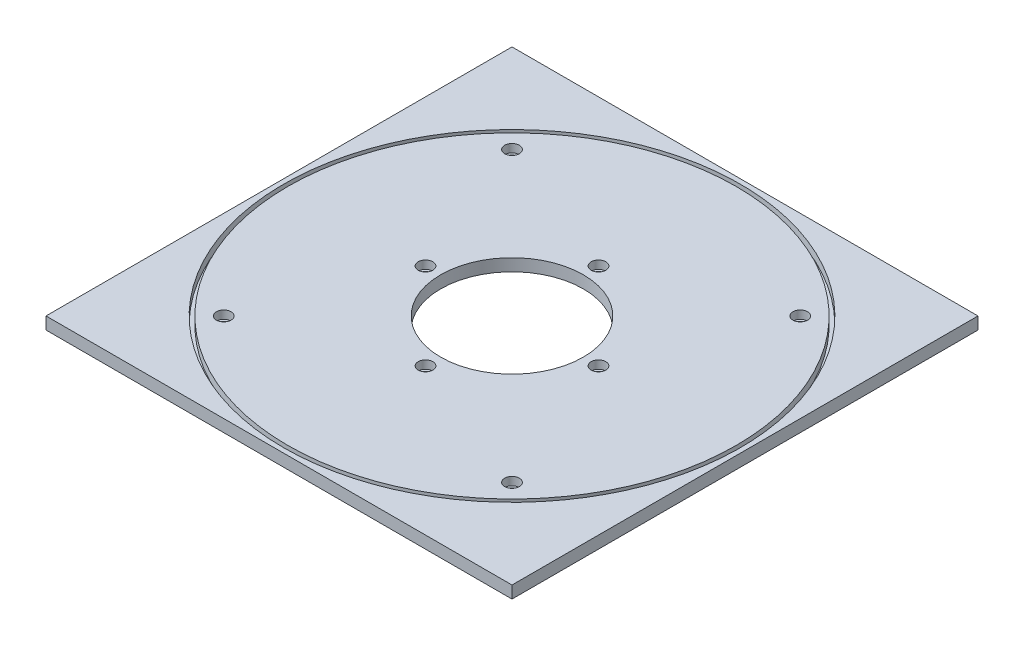
from build123d import *

# Parameters (mm, degrees)
SKETCH1_W                      = 571.5
SKETCH1_H                      = 571.5
PLATE_DEPTH                    = 15
SKETCH2_R                      = 87.5
BEARING_HOLE_DEPTH             = 405.389818121
SKETCH4_R                      = 280
SKETCH4_R_2                    = 275
CUT_EXTRUDE3_DEPTH             = 10
CBORE_FOR_M10_SHCS_D           = 12
CBORE_FOR_M10_SHCS_CBORE_D     = 18
CBORE_FOR_M10_SHCS_CBORE_DEPTH = 10


with BuildPart() as part:
    # Sketch1 → plate (new body)
    with BuildSketch(Plane(origin=(0, 0, 0), x_dir=(1, 0, 0), z_dir=(0, 1, 0))):
        Rectangle(SKETCH1_W, SKETCH1_H)
    extrude(amount=PLATE_DEPTH)

    # Sketch2 → bearing-hole (cut, through all)
    with BuildSketch(Plane(origin=(0, 15, 0), x_dir=(1, 0, 0), z_dir=(0, 1, 0))):
        Circle(SKETCH2_R)
    extrude(amount=-BEARING_HOLE_DEPTH, mode=Mode.SUBTRACT)

    # Sketch4 → Cut-Extrude3 (cut)
    with BuildSketch(Plane(origin=(0, 15, 0), x_dir=(1, 0, 0), z_dir=(0, 1, 0))):
        Circle(SKETCH4_R)
        Circle(SKETCH4_R_2, mode=Mode.SUBTRACT)
    extrude(amount=-CUT_EXTRUDE3_DEPTH, mode=Mode.SUBTRACT)

    # CBORE for M10 SHCS (through all)
    with Locations(Plane(origin=(0, 15, 0), x_dir=(1, 0, 0), z_dir=(0, 1, 0))):
        with Locations((0, 0), (-106.066017178, 0), (0, 106.066017178), (106.066017178, 0), (0, -106.066017178), (176.776695297, 176.776695297), (-176.776695297, 176.776695297), (176.776695297, -176.776695297), (-176.776695297, -176.776695297)):
            CounterBoreHole(CBORE_FOR_M10_SHCS_D / 2, CBORE_FOR_M10_SHCS_CBORE_D / 2, CBORE_FOR_M10_SHCS_CBORE_DEPTH)


solid = part.part
